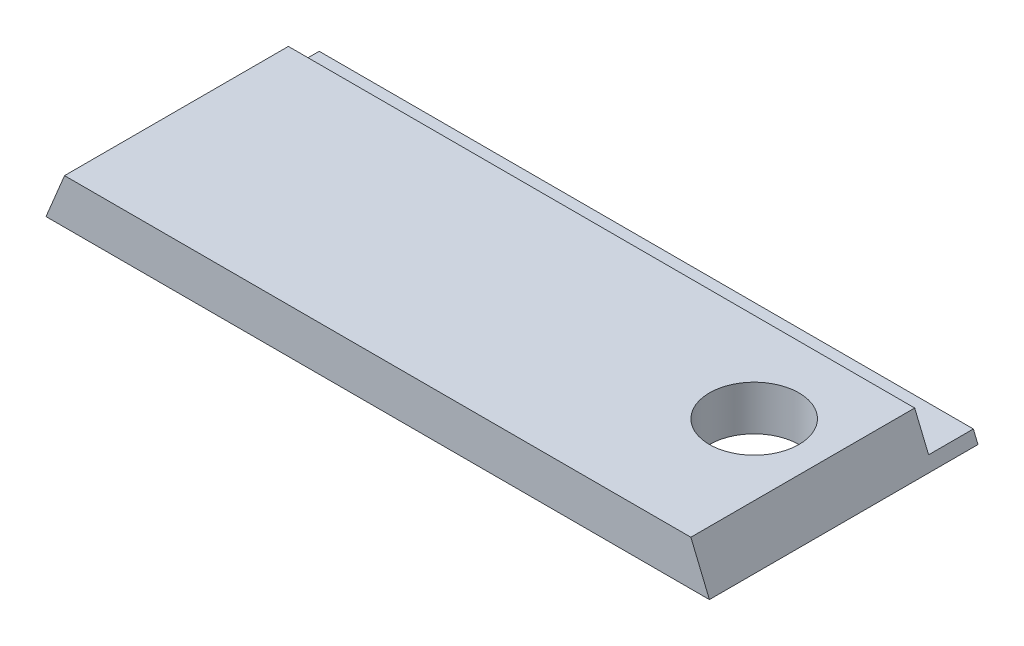
from build123d import *

# Parameters (mm, degrees)
BOSS_EXTRUDE1_DEPTH = 76.2
SKETCH2_W           = 188.214
SKETCH2_H           = 12.7
CUT_EXTRUDE1_DEPTH  = 9.525
SKETCH3_R           = 12.7
CUT_EXTRUDE2_DEPTH  = 204.450828939


with BuildPart() as part:
    # Sketch1 → Boss-Extrude1 (new body)
    with BuildSketch(Plane.XY):
        Polygon((0, 0), (188.214, 0), (182.953487758, 12.7), (5.260512242, 12.7), align=None)
    extrude(amount=BOSS_EXTRUDE1_DEPTH)

    # Sketch2 → Cut-Extrude1 (cut)
    with BuildSketch(Plane(origin=(0, 12.7, 0), x_dir=(1, 0, 0), z_dir=(0, 1, 0))):
        with Locations((94.107, -6.35)):
            Rectangle(SKETCH2_W, SKETCH2_H)
    extrude(amount=-CUT_EXTRUDE1_DEPTH, mode=Mode.SUBTRACT)

    # Sketch3 → Cut-Extrude2 (cut, through all)
    with BuildSketch(Plane.XZ):
        with Locations((162.814, 38.1)):
            Circle(SKETCH3_R)
    extrude(amount=-CUT_EXTRUDE2_DEPTH, mode=Mode.SUBTRACT)


solid = part.part
